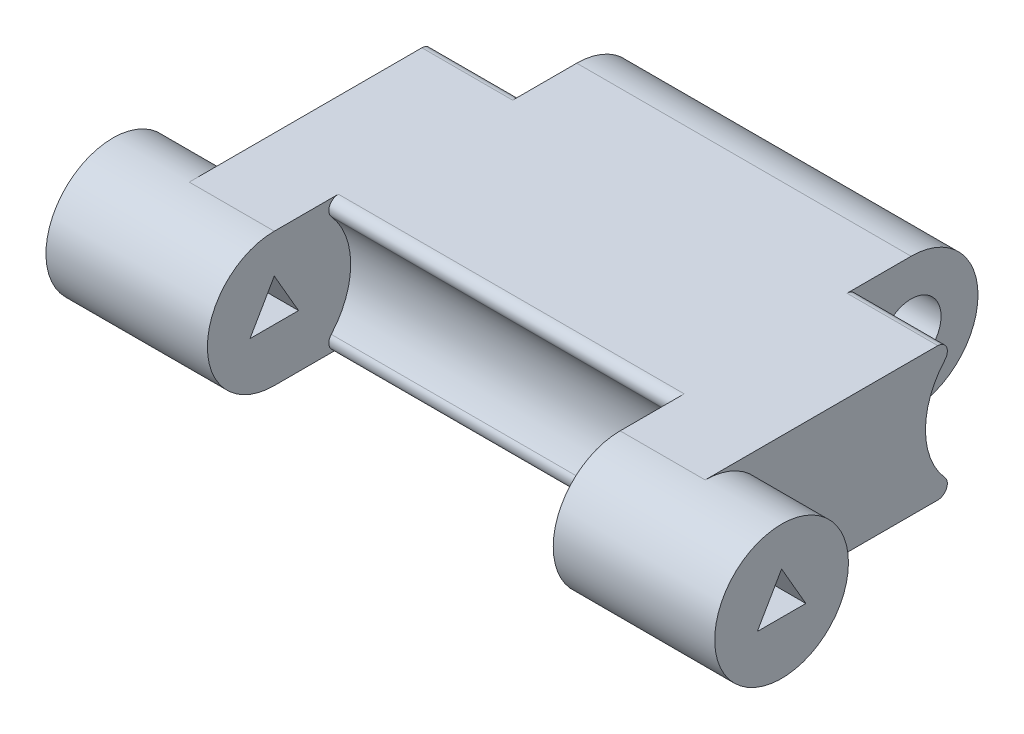
from build123d import *

# Parameters (mm, degrees)
EXTRUDE_1_DEPTH     = 17.5
SKETCH_3_W          = 24
SKETCH_3_H          = 9
SKETCH_3_R          = 3.5
CUT_EXTRUDE_1_DEPTH = 4
SKETCH_6_R          = 4
CUT_EXTRUDE_2_DEPTH = 9.05
SKETCH_7_R          = 4
CUT_EXTRUDE_3_DEPTH = 4.75
SKETCH_8_R          = 1.566666667
CUT_EXTRUDE_4_DEPTH = 38.428601697
FILLET_1_R          = 0.5
EXTRUDE_START       = -1
SKETCH_9_R          = 3.5
SKETCH_9_R_2        = 0.75
EXTRUDE_2_DEPTH     = 1


with BuildPart() as part:
    # Эскиз1 → Бобышка-Вытянуть1 (new, symmetric)
    with BuildSketch(Plane(origin=(0, 0, 0), x_dir=(0, 0, -1), z_dir=(1, 0, 0))):
        with BuildLine():
            Line((-7.765, 7), (7.765, 7))
            ThreePointArc((7.765, 7), (11.265, 3.5), (7.765, 0))
            Line((7.765, 0), (-7.765, 0))
            ThreePointArc((-7.765, 0), (-11.265, 3.5), (-7.765, 7))
        make_face()
    extrude(amount=EXTRUDE_1_DEPTH, both=True)

    # Эскиз3 → Вырез-Вытянуть1 (cut)
    with BuildSketch(Plane(origin=(17.5, 0, 0), x_dir=(0, 0, -1), z_dir=(1, 0, 0))):
        with Locations((0, 3.5)):
            Rectangle(SKETCH_3_W, SKETCH_3_H)
        with Locations((-7.765, 3.5)):
            Circle(SKETCH_3_R, mode=Mode.SUBTRACT)
    cut_extrude_1 = extrude(amount=-CUT_EXTRUDE_1_DEPTH, mode=Mode.SUBTRACT)

    # Зеркальное отражение1: Вырез-Вытянуть1 across plane
    add(cut_extrude_1.mirror(Plane(origin=(0, 0, 0), x_dir=(0, 0, 1), z_dir=(1, 0, 0))), mode=Mode.SUBTRACT)

    # Эскиз6 → Вырез-Вытянуть2 (cut, symmetric)
    with BuildSketch(Plane(origin=(0, 0, 0), x_dir=(0, 0, -1), z_dir=(1, 0, 0))):
        with Locations((-7.765, 3.5)):
            Circle(SKETCH_6_R)
    extrude(amount=CUT_EXTRUDE_2_DEPTH, both=True, mode=Mode.SUBTRACT)

    # Эскиз7 → Вырез-Вытянуть3 (cut)
    with BuildSketch(Plane(origin=(13.5, 0, 0), x_dir=(0, 0, -1), z_dir=(1, 0, 0))):
        with Locations((7.765, 3.5)):
            Circle(SKETCH_7_R)
    cut_extrude_3 = extrude(amount=-CUT_EXTRUDE_3_DEPTH, mode=Mode.SUBTRACT)

    # Зеркальное отражение2: Вырез-Вытянуть3 across plane
    add(cut_extrude_3.mirror(Plane(origin=(0, 0, 0), x_dir=(0, 0, 1), z_dir=(1, 0, 0))), mode=Mode.SUBTRACT)

    # Эскиз8 → Вырез-Вытянуть4 (cut, through all)
    with BuildSketch(Plane(origin=(17.5, 0, 0), x_dir=(0, 0, -1), z_dir=(1, 0, 0))):
        with Locations((7.765, 3.5)):
            Circle(SKETCH_8_R)
        Polygon((-9.035170592, 2.766666667), (-7.765, 4.966666667), (-6.494829408, 2.766666667), align=None)
    extrude(amount=-CUT_EXTRUDE_4_DEPTH, mode=Mode.SUBTRACT)

    # Скругление1
    fillet_1_edges = [part.edges().sort_by_distance(p)[0] for p in [
        (-11.125, 0, -5.828508327),
        (-11.125, 7, -5.828508327),
        (0, 7, 5.828508327),
        (0, 0, 5.828508327),
        (11.125, 7, -5.828508327),
        (11.125, 0, -5.828508327),
    ]]
    fillet(fillet_1_edges, radius=FILLET_1_R)

    # Эскиз9 → Бобышка-Вытянуть2 (add)
    with BuildSketch(Plane.ZY.offset(17.5).offset(EXTRUDE_START)):
        with Locations((7.765, 3.5)):
            Circle(SKETCH_9_R)
        with Locations((7.765, 3.5)):
            Circle(SKETCH_9_R_2, mode=Mode.SUBTRACT)
    extrude(amount=EXTRUDE_2_DEPTH)


solid = part.part
